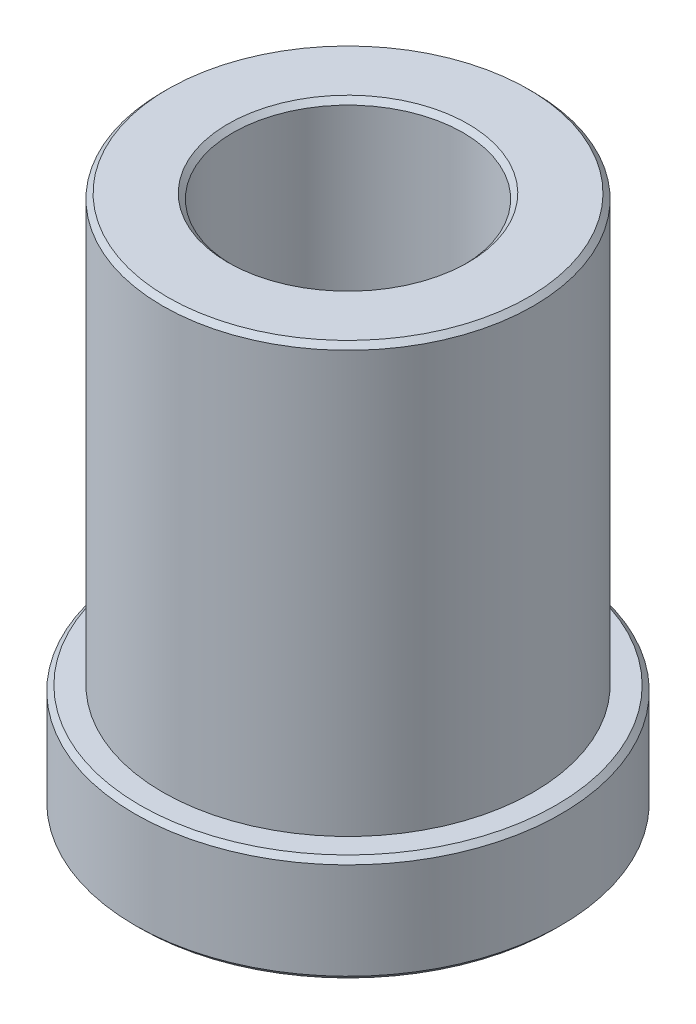
from build123d import *

# Parameters (mm, degrees)
SKETCH1_R           = 11.049
BOSS_EXTRUDE1_DEPTH = 25.4
SKETCH2_R           = 12.7
BOSS_EXTRUDE2_DEPTH = 6.35
SKETCH3_R           = 6.858
CUT_EXTRUDE1_DEPTH  = 37.477972806
CHAMFER1_SIZE       = 0.299999908


with BuildPart() as part:
    # Sketch1 → Boss-Extrude1 (new body)
    with BuildSketch(Plane(origin=(0, 0, 0), x_dir=(1, 0, 0), z_dir=(0, 1, 0))):
        Circle(SKETCH1_R)
    extrude(amount=BOSS_EXTRUDE1_DEPTH)

    # Sketch2 → Boss-Extrude2 (add)
    with BuildSketch(Plane.XZ):
        Circle(SKETCH2_R)
    extrude(amount=BOSS_EXTRUDE2_DEPTH)

    # Sketch3 → Cut-Extrude1 (cut, through all)
    with BuildSketch(Plane.XZ.offset(6.35)):
        Circle(SKETCH3_R)
    extrude(amount=-CUT_EXTRUDE1_DEPTH, mode=Mode.SUBTRACT)

    # Chamfer1
    chamfer1_edges = [part.edges().sort_by_distance(p)[0] for p in [
        (-12.7, 0, 0),
        (-12.7, -6.35, 0),
        (-11.049, 25.4, 0),
        (-6.858, 25.4, 0),
        (-6.858, -6.35, 0),
    ]]
    chamfer(chamfer1_edges, length=CHAMFER1_SIZE)


solid = part.part
